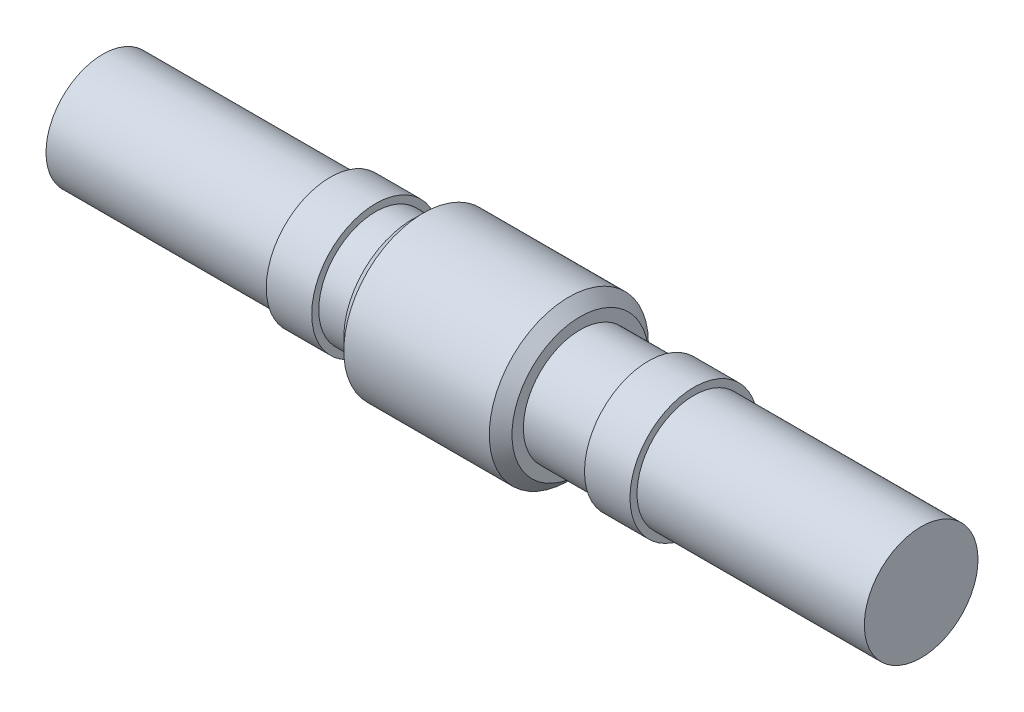
from build123d import *

# Parameters (mm, degrees)
CROQUIS1_R              = 35
SALIENTE_EXTRUIR1_DEPTH = 37
CHAFL_N1_SIZE           = 5
CROQUIS2_R              = 25
SALIENTE_EXTRUIR2_DEPTH = 16
CROQUIS3_R              = 28.1
SALIENTE_EXTRUIR3_DEPTH = 120
SALIENTE_EXTRUIR4_START = 30
CROQUIS4_R              = 25
SALIENTE_EXTRUIR4_DEPTH = 30
SALIENTE_EXTRUIR5_START = 120
CROQUIS5_R              = 28.1
SALIENTE_EXTRUIR5_DEPTH = 120
CORTAR_EXTRUIR1_START   = -100
CROQUIS6_R              = 28.1
CROQUIS6_R_2            = 25
CORTAR_EXTRUIR1_DEPTH   = 100
CROQUIS8_R              = 28.1
CROQUIS8_R_2            = 25
CORTAR_EXTRUIR2_DEPTH   = 100


with BuildPart() as part:
    # Croquis1 → Saliente-Extruir1 (new, symmetric)
    with BuildSketch(Plane(origin=(0, 0, 0), x_dir=(0, 0, -1), z_dir=(1, 0, 0))):
        Circle(CROQUIS1_R)
    extrude(amount=SALIENTE_EXTRUIR1_DEPTH, both=True)

    # Chaflán1
    chafl_n1_edges = [part.edges().sort_by_distance(p)[0] for p in [
        (37, 0, 35),
        (-37, 0, 35),
    ]]
    chamfer(chafl_n1_edges, length=CHAFL_N1_SIZE)

    # Croquis2 → Saliente-Extruir2 (add)
    with BuildSketch(Plane.ZY.offset(37)):
        Circle(CROQUIS2_R)
    extrude(amount=SALIENTE_EXTRUIR2_DEPTH)

    # Croquis3 → Saliente-Extruir3 (add)
    with BuildSketch(Plane.ZY.offset(53)):
        Circle(CROQUIS3_R)
    extrude(amount=SALIENTE_EXTRUIR3_DEPTH)

    # Croquis4 → Saliente-Extruir4 (add)
    with BuildSketch(Plane(origin=(37, 0, 0), x_dir=(0, 0, -1), z_dir=(1, 0, 0)).offset(SALIENTE_EXTRUIR4_START)):
        Circle(CROQUIS4_R)
    extrude(amount=-SALIENTE_EXTRUIR4_DEPTH)

    # Croquis5 → Saliente-Extruir5 (add)
    with BuildSketch(Plane(origin=(67, 0, 0), x_dir=(0, 0, -1), z_dir=(1, 0, 0)).offset(SALIENTE_EXTRUIR5_START)):
        Circle(CROQUIS5_R)
    extrude(amount=-SALIENTE_EXTRUIR5_DEPTH)

    # Croquis6 → Cortar-Extruir1 (cut)
    with BuildSketch(Plane.ZY.offset(173).offset(CORTAR_EXTRUIR1_START)):
        Circle(CROQUIS6_R)
        Circle(CROQUIS6_R_2, mode=Mode.SUBTRACT)
    extrude(amount=CORTAR_EXTRUIR1_DEPTH, mode=Mode.SUBTRACT)

    # Croquis8 → Cortar-Extruir2 (cut)
    with BuildSketch(Plane(origin=(187, 0, 0), x_dir=(0, 0, -1), z_dir=(1, 0, 0))):
        Circle(CROQUIS8_R)
        Circle(CROQUIS8_R_2, mode=Mode.SUBTRACT)
    extrude(amount=-CORTAR_EXTRUIR2_DEPTH, mode=Mode.SUBTRACT)


solid = part.part
